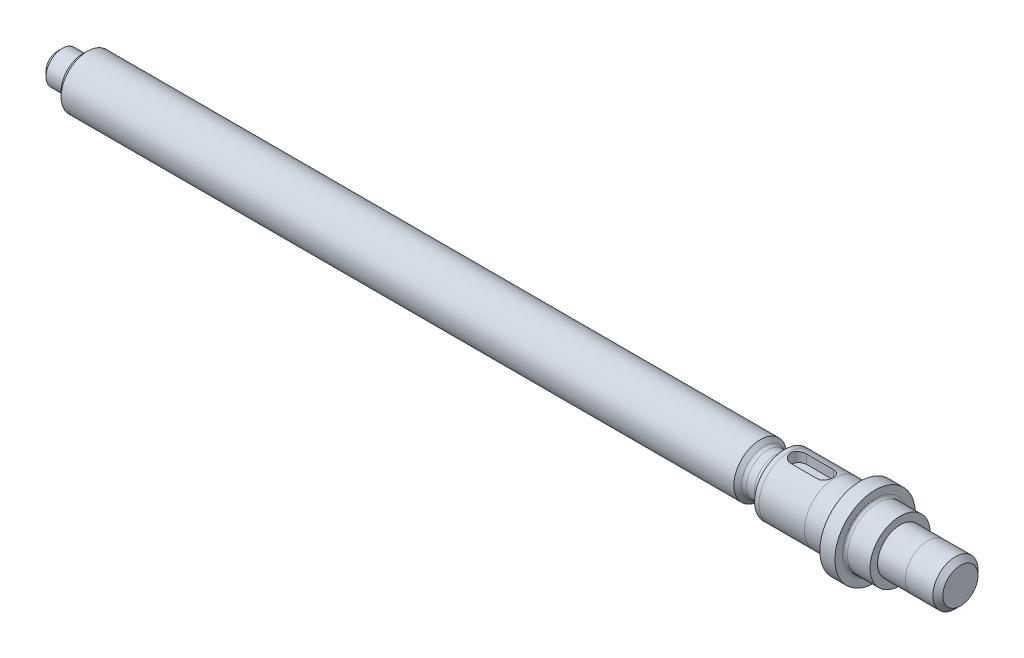
from build123d import *

# Parameters (mm, degrees)
FILLET_1_R          = 0.5
FILLET_2_R          = 0.5
FILLET_3_R          = 1
FILLET_4_R          = 0.5
CHAMFER_1_SIZE      = 1
CHAMFER_2_SIZE      = 1
CUT_EXTRUDE_1_DEPTH = 6


with BuildPart() as part:
    # Эскиз1 → Повернуть1 (revolve)
    with BuildSketch(Plane(origin=(0, 0, 0), x_dir=(1, 0, 0), z_dir=(0, 1, 0))):
        with BuildLine():
            Line((55.756411679, -2.497269463), (55.756411679, -6.997269463))
            Line((55.756411679, -6.997269463), (43.756411679, -6.997269463))
            Line((43.756411679, -6.997269463), (43.756411679, -8.497269463))
            Line((43.756411679, -8.497269463), (38.756411679, -8.497269463))
            Line((38.756411679, -8.497269463), (38.756411679, -10.497269463))
            Line((38.756411679, -10.497269463), (35.756411679, -10.497269463))
            Line((35.756411679, -10.497269463), (35.756411679, -8.497269463))
            Line((35.756411679, -8.497269463), (20.756411679, -8.497269463))
            ThreePointArc((20.756411679, -8.497269463), (20.229203885, -7.224477257), (18.956411679, -6.697269463))
            Line((18.956411679, -6.697269463), (16.956411679, -6.697269463))
            Line((16.956411679, -6.697269463), (15.895751507, -7.757929635))
            Line((15.895751507, -7.757929635), (-119.089435131, -7.757929635))
            Line((-119.089435131, -7.757929635), (-119.089435131, -5.757929635))
            Line((-119.089435131, -5.757929635), (-124.089435131, -5.757929635))
            Line((-124.089435131, -5.757929635), (-124.089435131, -2.497269463))
            Line((-124.089435131, -2.497269463), (55.756411679, -2.497269463))
        make_face()
    revolve(axis=Axis((55.756411679, 0, 2.497269463), (-1, 0, 0)))

    # Скругление1
    fillet_1_edges = [part.edges().sort_by_distance(p)[0] for p in [
        (35.756411679, 0, -3.502730537),
    ]]
    fillet(fillet_1_edges, radius=FILLET_1_R)

    # Скругление2
    fillet_2_edges = [part.edges().sort_by_distance(p)[0] for p in [
        (38.756411679, 0, -3.502730537),
    ]]
    fillet(fillet_2_edges, radius=FILLET_2_R)

    # Скругление3
    fillet_3_edges = [part.edges().sort_by_distance(p)[0] for p in [
        (16.956411679, 0, -1.702730537),
    ]]
    fillet(fillet_3_edges, radius=FILLET_3_R)

    # Скругление4
    fillet_4_edges = [part.edges().sort_by_distance(p)[0] for p in [
        (-119.089435131, 0, -0.763390709),
    ]]
    fillet(fillet_4_edges, radius=FILLET_4_R)

    # Фаска1
    chamfer_1_edges = [part.edges().sort_by_distance(p)[0] for p in [
        (55.756411679, 0, -2.002730537),
        (-119.089435131, 0, -2.763390709),
    ]]
    chamfer(chamfer_1_edges, length=CHAMFER_1_SIZE)

    # Фаска2
    chamfer_2_edges = [part.edges().sort_by_distance(p)[0] for p in [
        (-124.089435131, 0, -0.763390709),
    ]]
    chamfer(chamfer_2_edges, length=CHAMFER_2_SIZE)

    # Эскиз2 → Вырез-Вытянуть1 (cut)
    with BuildSketch(Plane(origin=(0, 10, 0), x_dir=(1, 0, 0), z_dir=(0, 1, 0))):
        with BuildLine():
            Line((23.550856254, -0.902866319), (28.868398961, -0.902866319))
            ThreePointArc((28.868398961, -0.902866319), (30.462802104, -2.497269463), (28.868398961, -4.091672607))
            Line((28.868398961, -4.091672607), (23.550856254, -4.091672607))
            ThreePointArc((23.550856254, -4.091672607), (21.95645311, -2.497269463), (23.550856254, -0.902866319))
        make_face()
    extrude(amount=-CUT_EXTRUDE_1_DEPTH, mode=Mode.SUBTRACT)


solid = part.part
